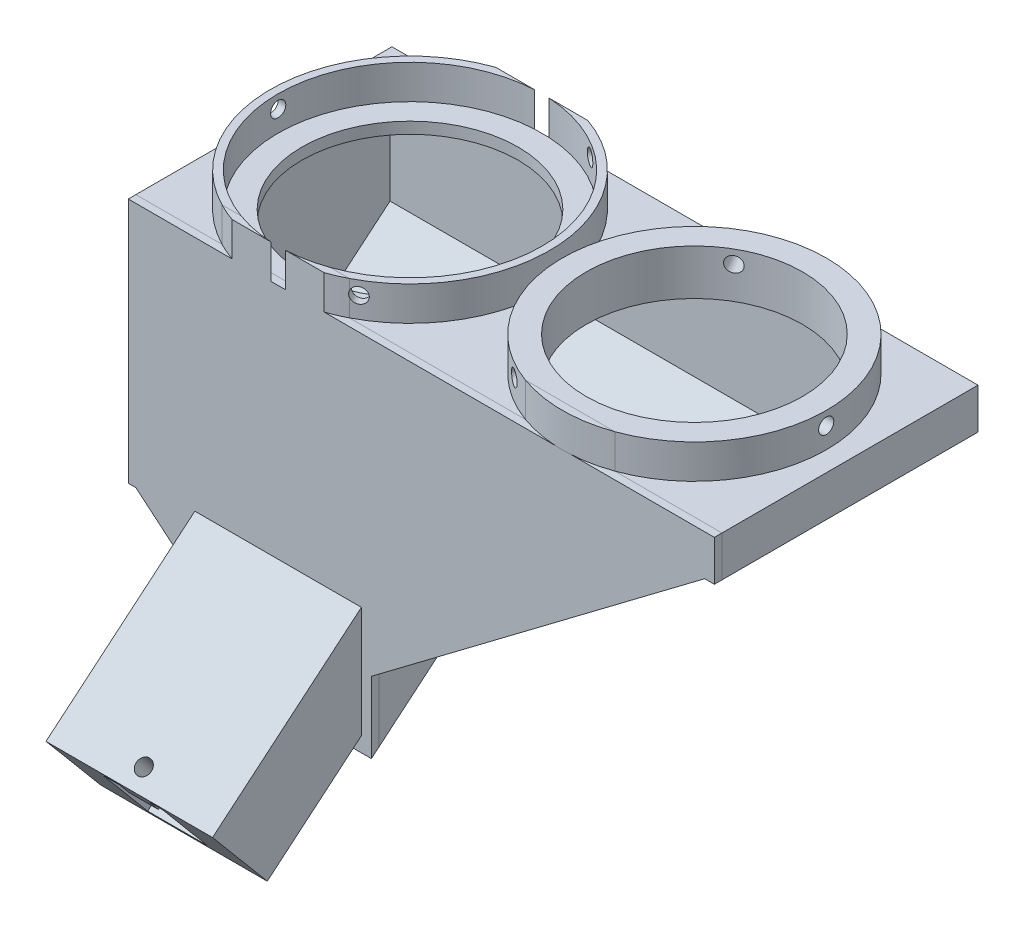
from build123d import *

# Parameters (mm, degrees)
BOSS_EXTRUDE1_DEPTH             = 65
BOSS_EXTRUDE2_DEPTH             = 2.5
BOSS_EXTRUDE3_REACH             = 149.881
BOSS_EXTRUDE3_DIRECTION_2_REACH = 149.881
BOSS_EXTRUDE4_START             = 65
BOSS_EXTRUDE4_DEPTH             = 2
CUT_EXTRUDE1_REACH              = 142.208
BOSS_EXTRUDE8_START             = 9
SKETCH6_3_R                     = 34.8
SKETCH6_3_R_2                   = 28.5
BOSS_EXTRUDE8_DEPTH             = 9
SKETCH7_R                       = 2
CUT_EXTRUDE2_DEPTH              = 10
CIRPATTERN1_COUNT               = 3
MIRROR1_COPY_1_SKETCH_R         = 2
MIRROR1_COPY_1_DEPTH            = 10
MIRROR1_COPY_2_SKETCH_R         = 2
MIRROR1_COPY_2_DEPTH            = 10
CUT_EXTRUDE3_REACH              = 172.879
SKETCH8_R                       = 6
CUT_EXTRUDE3_DIRECTION_2_DEPTH  = 10
SKETCH11_W                      = 15.771364288
SKETCH11_H                      = 18.45
CUT_EXTRUDE4_DEPTH              = 41
BOSS_EXTRUDE9_REACH             = 172.575
SKETCH11_4_W                    = 43.9
SKETCH11_4_H                    = 22.45
SKETCH11_4_W_2                  = 15.771364288
SKETCH11_4_H_2                  = 18.45
BOSS_EXTRUDE9_DIRECTION_2_DEPTH = 15
SKETCH12_R                      = 2
CUT_EXTRUDE5_DEPTH              = 10
SKETCH12_3_W                    = 7.713234289
SKETCH12_3_H                    = 8.905912671
SKETCH12_3_R                    = 2
BOSS_EXTRUDE10_DEPTH            = 6


# Read off the part's stored shape, not the designer's step: Boss-Extrude4, Split1
with BuildPart() as part:
    # Sketch1 → Boss-Extrude1 (new body)
    with BuildSketch(Plane.XY):
        Polygon((-77, 83), (-77, 18.093338959), (-75, 18.093338959), (-53.437198293, 0), (-53.437198293, -60.895871616), (-47.214302986, -60.895871616), (-47.214302986, 0), (-75, 23.314968117), (-75, 80), (75, 80), (75, 75.447534774), (-26.205389597, -0.816196449), (-26.205389597, -60.895871616), (-12.91141852, -60.895871616), (-12.91141852, 6.071190153), (75, 72.317195629), (75, 72.277389629), (77.5, 72.277389629), (77.5, 83), align=None)
    extrude(amount=BOSS_EXTRUDE1_DEPTH)

    # Sketch1<3> → Boss-Extrude2 (add)
    with BuildSketch(Plane.XY):
        Polygon((75, 72.317195629), (75, 72.277389629), (77.5, 72.277389629), (77.5, 83), (-77, 83), (-77, 18.093338959), (-75, 18.093338959), (-53.437198293, 0), (-53.437198293, -60.895871616), (-12.91141852, -60.895871616), (-12.91141852, 0), (-20.968159973, 0), align=None)
    extrude(amount=-BOSS_EXTRUDE2_DEPTH)

    # Sketch4 → Boss-Extrude3 (add, up to next)
    with BuildSketch(Plane.ZY.offset(26.205389597), mode=Mode.PRIVATE) as boss_extrude3_sk1:
        Polygon((65, -4.519089787), (0, 50.02238624), (0, 47.411571661), (65, -7.129904365), align=None)
    boss_extrude3_tool1 = extrude(boss_extrude3_sk1.sketch, amount=BOSS_EXTRUDE3_REACH, mode=Mode.PRIVATE) - part.part
    add(boss_extrude3_tool1.solids().sort_by_distance((-26.20539, 21.446241, 32.5))[0])

    # Sketch4 → Boss-Extrude3 direction 2 (add, up to next)
    with BuildSketch(Plane.ZY.offset(26.205389597), mode=Mode.PRIVATE) as boss_extrude3_direction_2_sk1:
        Polygon((65, -4.519089787), (0, 50.02238624), (0, 47.411571661), (65, -7.129904365), align=None)
    boss_extrude3_direction_2_tool1 = extrude(boss_extrude3_direction_2_sk1.sketch, amount=-BOSS_EXTRUDE3_DIRECTION_2_REACH, mode=Mode.PRIVATE) - part.part
    add(boss_extrude3_direction_2_tool1.solids().sort_by_distance((-26.20539, 21.446241, 32.5))[0])

    # Boss-Extrude4 outline → Boss-Extrude4 (add)
    with BuildSketch(Plane.XY.offset(BOSS_EXTRUDE4_START)):
        Polygon((-12.91141852, -60.895871616), (-12.91141852, 6.071190153), (75, 72.317195629), (75, 72.277389629), (77.5, 72.277389629), (77.5, 83), (-77, 83), (-77, 18.093338959), (-75, 18.093338959), (-53.437198293, 0), (-53.437198293, -60.895871616), align=None)
    extrude(amount=BOSS_EXTRUDE4_DEPTH)

    # SurfaceCut1
    split(bisect_by=Plane(origin=(0, 25.524119011, 21.417278848), x_dir=(-1, 0, 0), z_dir=(0, -0.7660444431189819, -0.6427876096865347)), keep=Keep.BOTTOM)

    # Sketch6 → Cut-Extrude1 (cut, up to next)
    with BuildSketch(Plane(origin=(0, 83, 0), x_dir=(1, 0, 0), z_dir=(0, 1, 0)), mode=Mode.PRIVATE) as cut_extrude1_sk1:
        with BuildLine():
            ThreePointArc((-65.985370625, -32.25), (-37.485370625, -60.75), (-8.985370625, -32.25))
            Line((-8.985370625, -32.25), (-65.985370625, -32.25))
        make_face()
    cut_extrude1_tool1 = extrude(cut_extrude1_sk1.sketch, amount=-CUT_EXTRUDE1_REACH, mode=Mode.PRIVATE) & part.part
    # Sketch6 → Cut-Extrude1 (cut, up to next)
    with BuildSketch(Plane(origin=(0, 83, 0), x_dir=(1, 0, 0), z_dir=(0, 1, 0)), mode=Mode.PRIVATE) as cut_extrude1_sk2:
        with BuildLine():
            Line((-65.985370625, -32.25), (-8.985370625, -32.25))
            ThreePointArc((-8.985370625, -32.25), (-37.485370625, -3.75), (-65.985370625, -32.25))
        make_face()
    cut_extrude1_tool2 = extrude(cut_extrude1_sk2.sketch, amount=-CUT_EXTRUDE1_REACH, mode=Mode.PRIVATE) & part.part
    # Sketch6 → Cut-Extrude1 (cut, up to next)
    with BuildSketch(Plane(origin=(0, 83, 0), x_dir=(1, 0, 0), z_dir=(0, 1, 0)), mode=Mode.PRIVATE) as cut_extrude1_sk3:
        with BuildLine():
            ThreePointArc((-65.985370625, -32.25), (-37.485370625, -60.75), (-8.985370625, -32.25))
            Line((-8.985370625, -32.25), (-65.985370625, -32.25))
        make_face()
    cut_extrude1_tool3 = extrude(cut_extrude1_sk3.sketch, amount=-CUT_EXTRUDE1_REACH, mode=Mode.PRIVATE) & part.part
    # Sketch6 → Cut-Extrude1 (cut, up to next)
    with BuildSketch(Plane(origin=(0, 83, 0), x_dir=(1, 0, 0), z_dir=(0, 1, 0)), mode=Mode.PRIVATE) as cut_extrude1_sk4:
        with BuildLine():
            Line((-65.985370625, -32.25), (-8.985370625, -32.25))
            ThreePointArc((-8.985370625, -32.25), (-37.485370625, -3.75), (-65.985370625, -32.25))
        make_face()
    cut_extrude1_tool4 = extrude(cut_extrude1_sk4.sketch, amount=-CUT_EXTRUDE1_REACH, mode=Mode.PRIVATE) & part.part
    # Sketch6 → Cut-Extrude1 (cut, up to next)
    with BuildSketch(Plane(origin=(0, 83, 0), x_dir=(1, 0, 0), z_dir=(0, 1, 0)), mode=Mode.PRIVATE) as cut_extrude1_sk5:
        with BuildLine():
            ThreePointArc((65.985370625, -32.25), (37.485370625, -3.75), (8.985370625, -32.25))
            Line((8.985370625, -32.25), (65.985370625, -32.25))
        make_face()
    cut_extrude1_tool5 = extrude(cut_extrude1_sk5.sketch, amount=-CUT_EXTRUDE1_REACH, mode=Mode.PRIVATE) & part.part
    # Sketch6 → Cut-Extrude1 (cut, up to next)
    with BuildSketch(Plane(origin=(0, 83, 0), x_dir=(1, 0, 0), z_dir=(0, 1, 0)), mode=Mode.PRIVATE) as cut_extrude1_sk6:
        with BuildLine():
            Line((65.985370625, -32.25), (8.985370625, -32.25))
            ThreePointArc((8.985370625, -32.25), (37.485370625, -60.75), (65.985370625, -32.25))
        make_face()
    cut_extrude1_tool6 = extrude(cut_extrude1_sk6.sketch, amount=-CUT_EXTRUDE1_REACH, mode=Mode.PRIVATE) & part.part
    # Sketch6 → Cut-Extrude1 (cut, up to next)
    with BuildSketch(Plane(origin=(0, 83, 0), x_dir=(1, 0, 0), z_dir=(0, 1, 0)), mode=Mode.PRIVATE) as cut_extrude1_sk7:
        with BuildLine():
            ThreePointArc((65.985370625, -32.25), (37.485370625, -3.75), (8.985370625, -32.25))
            Line((8.985370625, -32.25), (65.985370625, -32.25))
        make_face()
    cut_extrude1_tool7 = extrude(cut_extrude1_sk7.sketch, amount=-CUT_EXTRUDE1_REACH, mode=Mode.PRIVATE) & part.part
    # Sketch6 → Cut-Extrude1 (cut, up to next)
    with BuildSketch(Plane(origin=(0, 83, 0), x_dir=(1, 0, 0), z_dir=(0, 1, 0)), mode=Mode.PRIVATE) as cut_extrude1_sk8:
        with BuildLine():
            Line((65.985370625, -32.25), (8.985370625, -32.25))
            ThreePointArc((8.985370625, -32.25), (37.485370625, -60.75), (65.985370625, -32.25))
        make_face()
    cut_extrude1_tool8 = extrude(cut_extrude1_sk8.sketch, amount=-CUT_EXTRUDE1_REACH, mode=Mode.PRIVATE) & part.part
    add(cut_extrude1_tool1.solids().sort_by_distance((-37.485371, 83, 44.345776))[0], mode=Mode.SUBTRACT)
    add(cut_extrude1_tool2.solids().sort_by_distance((-37.485371, 83, 20.154224))[0], mode=Mode.SUBTRACT)
    add(cut_extrude1_tool3.solids().sort_by_distance((-37.485371, 83, 44.345776))[0], mode=Mode.SUBTRACT)
    add(cut_extrude1_tool4.solids().sort_by_distance((-37.485371, 83, 20.154224))[0], mode=Mode.SUBTRACT)
    add(cut_extrude1_tool5.solids().sort_by_distance((37.485371, 83, 20.154224))[0], mode=Mode.SUBTRACT)
    add(cut_extrude1_tool6.solids().sort_by_distance((37.485371, 83, 44.345776))[0], mode=Mode.SUBTRACT)
    add(cut_extrude1_tool7.solids().sort_by_distance((37.485371, 83, 20.154224))[0], mode=Mode.SUBTRACT)
    add(cut_extrude1_tool8.solids().sort_by_distance((37.485371, 83, 44.345776))[0], mode=Mode.SUBTRACT)

    # Sketch6<3> → Boss-Extrude8 (add)
    # profile 1 of 3: a face of its own
    with BuildSketch(Plane(origin=(0, 83, 0), x_dir=(1, 0, 0), z_dir=(0, 1, 0)).offset(BOSS_EXTRUDE8_START)):
        with BuildLine():
            Line((-39.350176245, 2.5), (-49.5964193, 2.5))
            ThreePointArc((-49.5964193, 2.5), (-74.285370625, -32.25), (-49.5964193, -67))
            Line((-49.5964193, -67), (-39.350176245, -67))
            ThreePointArc((-39.350176245, -67), (-72.285370625, -32.25), (-39.350176245, 2.5))
        make_face()
    # profile 2 of 3: a face of its own
    with BuildSketch(Plane(origin=(0, 83, 0), x_dir=(1, 0, 0), z_dir=(0, 1, 0)).offset(BOSS_EXTRUDE8_START)):
        with BuildLine():
            ThreePointArc((-25.374321951, -67), (-0.685370625, -32.25), (-25.374321951, 2.5))
            Line((-25.374321951, 2.5), (-35.620565006, 2.5))
            ThreePointArc((-35.620565006, 2.5), (-2.685370625, -32.25), (-35.620565006, -67))
            Line((-35.620565006, -67), (-25.374321951, -67))
        make_face()
    # profile 3 of 3: a face of its own
    with BuildSketch(Plane(origin=(0, 83, 0), x_dir=(1, 0, 0), z_dir=(0, 1, 0)).offset(BOSS_EXTRUDE8_START)):
        with Locations(Location((37.485370625, -32.25, 0), (0, 0, 86.928255969))):
            Circle(SKETCH6_3_R)
        with Locations(Location((37.485370625, -32.25, 0), (0, 0, 270))):
            Circle(SKETCH6_3_R_2, mode=Mode.SUBTRACT)
    extrude(amount=-BOSS_EXTRUDE8_DEPTH)

    # Sketch7 → Cut-Extrude2 (cut, symmetric)
    with BuildSketch(Plane(origin=(-72.285370625, 0, 0), x_dir=(0, 0, -1), z_dir=(1, 0, 0))):
        with Locations((-32.25, 88.5)):
            Circle(SKETCH7_R)
    cut_extrude2 = extrude(amount=CUT_EXTRUDE2_DEPTH, both=True, mode=Mode.SUBTRACT)

    # CirPattern1: Cut-Extrude2 ×3 about axis
    cirpattern1_axis = Axis((-37.485370625, -12.725325496, 32.25), (0, 1, 0))
    for i in range(1, CIRPATTERN1_COUNT):
        add(cut_extrude2.rotate(cirpattern1_axis, i * 360 / CIRPATTERN1_COUNT), mode=Mode.SUBTRACT)

    # Mirror1: Cut-Extrude2 across plane
    add(cut_extrude2.mirror(Plane.ZY), mode=Mode.SUBTRACT)

    # Mirror1 copy 1 sketch → Mirror1 copy 1 (cut, symmetric)
    with BuildSketch(Plane(origin=(48.014689897, 0, 78.512684052), x_dir=(0.8660254037844421, 5.941365548682438e-15, 0.49999999999999384), z_dir=(0.49999999999999384, 3.430248998885745e-15, -0.8660254037844421))):
        with Locations((-32.25, -88.5)):
            Circle(MIRROR1_COPY_1_SKETCH_R)
    extrude(amount=MIRROR1_COPY_1_DEPTH, both=True, mode=Mode.SUBTRACT)

    # Mirror1 copy 2 sketch → Mirror1 copy 2 (cut, symmetric)
    with BuildSketch(Plane(origin=(-7.843948647, 0, 18.237315948), x_dir=(-0.8660254037844349, -5.941365548682412e-15, 0.5000000000000064), z_dir=(0.5000000000000064, 3.4302489988857906e-15, 0.8660254037844349))):
        with Locations((-32.25, -88.5)):
            Circle(MIRROR1_COPY_2_SKETCH_R)
    extrude(amount=MIRROR1_COPY_2_DEPTH, both=True, mode=Mode.SUBTRACT)

    # Sketch8 → Cut-Extrude3 (cut, up to next)
    with BuildSketch(Plane.XZ.offset(44.738995484), mode=Mode.PRIVATE) as cut_extrude3_sk1:
        with Locations(Location((-37.5, 55.818578051, 0), (0, 0, 90))):
            Circle(SKETCH8_R)
    cut_extrude3_tool1 = extrude(cut_extrude3_sk1.sketch, amount=-CUT_EXTRUDE3_REACH, mode=Mode.PRIVATE) & part.part
    add(cut_extrude3_tool1.solids().sort_by_distance((-37.5, -44.738995, 55.818578))[0], mode=Mode.SUBTRACT)

    # Sketch8 → Cut-Extrude3 direction 2 (cut)
    with BuildSketch(Plane.XZ.offset(44.738995484)):
        with Locations(Location((-37.5, 55.818578051, 0), (0, 0, 90))):
            Circle(SKETCH8_R)
    extrude(amount=CUT_EXTRUDE3_DIRECTION_2_DEPTH, mode=Mode.SUBTRACT)

    # Sketch11 → Cut-Extrude4 (cut)
    with BuildSketch(Plane(origin=(0, -47.807908899, 56.975247185), x_dir=(1, 0, 0), z_dir=(0, 0.642787609686535, -0.7660444431189818))):
        with Locations((-37.893370091, -47.544371011)):
            Rectangle(SKETCH11_W, SKETCH11_H)
    extrude(amount=CUT_EXTRUDE4_DEPTH, mode=Mode.SUBTRACT)

    # Sketch11<4> → Boss-Extrude9 (add, up to next)
    with BuildSketch(Plane(origin=(0, -47.807908899, 56.975247185), x_dir=(1, 0, 0), z_dir=(0, 0.642787609686535, -0.7660444431189818)), mode=Mode.PRIVATE) as boss_extrude9_sk1:
        with Locations((-37.5, -47.544371011)):
            Rectangle(SKETCH11_4_W, SKETCH11_4_H)
        with Locations((-37.893370091, -47.544371011)):
            Rectangle(SKETCH11_4_W_2, SKETCH11_4_H_2, mode=Mode.SUBTRACT)
    boss_extrude9_tool1 = extrude(boss_extrude9_sk1.sketch, amount=BOSS_EXTRUDE9_REACH, mode=Mode.PRIVATE) - part.part
    add(boss_extrude9_tool1.solids().sort_by_distance((-58.956927, -11.386808, 87.53618))[0])

    # Sketch11<4> → Boss-Extrude9 direction 2 (add)
    with BuildSketch(Plane(origin=(0, -47.807908899, 56.975247185), x_dir=(1, 0, 0), z_dir=(0, 0.642787609686535, -0.7660444431189818))):
        with Locations((-37.5, -47.544371011)):
            Rectangle(SKETCH11_4_W, SKETCH11_4_H)
        with Locations((-37.893370091, -47.544371011)):
            Rectangle(SKETCH11_4_W_2, SKETCH11_4_H_2, mode=Mode.SUBTRACT)
    extrude(amount=-BOSS_EXTRUDE9_DIRECTION_2_DEPTH)

    # Sketch12 → Cut-Extrude5 (cut)
    with BuildSketch(Plane(origin=(0, 45.019950088, 37.776223515), x_dir=(1, 0, 0), z_dir=(0, 0.7660444431189818, 0.642787609686535))):
        with Locations(Location((-37.5, -84.375902987, 0), (0, 0, 270))):
            Circle(SKETCH12_R)
    extrude(amount=-CUT_EXTRUDE5_DEPTH, mode=Mode.SUBTRACT)

    # Sketch12<3> → Boss-Extrude10 (add)
    with BuildSketch(Plane(origin=(0, 45.019950088, 37.776223515), x_dir=(1, 0, 0), z_dir=(0, 0.7660444431189818, 0.642787609686535))):
        with Locations((-37.530653736, -84.922946652)):
            Rectangle(SKETCH12_3_W, SKETCH12_3_H)
        with Locations(Location((-37.5, -84.375902987, 0), (0, 0, 270))):
            Circle(SKETCH12_3_R, mode=Mode.SUBTRACT)
    extrude(amount=-BOSS_EXTRUDE10_DEPTH)


with BuildPart() as body_2:
    # Split1: the piece on the far side of the plane
    add(part.part)
    split(bisect_by=Plane.XY.offset(65), keep=Keep.BOTTOM)


with BuildPart() as part_1:
    add(part.part)

    # Split1
    split(bisect_by=Plane.XY.offset(65), keep=Keep.TOP)


solid = Compound([body_2.part, part_1.part])
